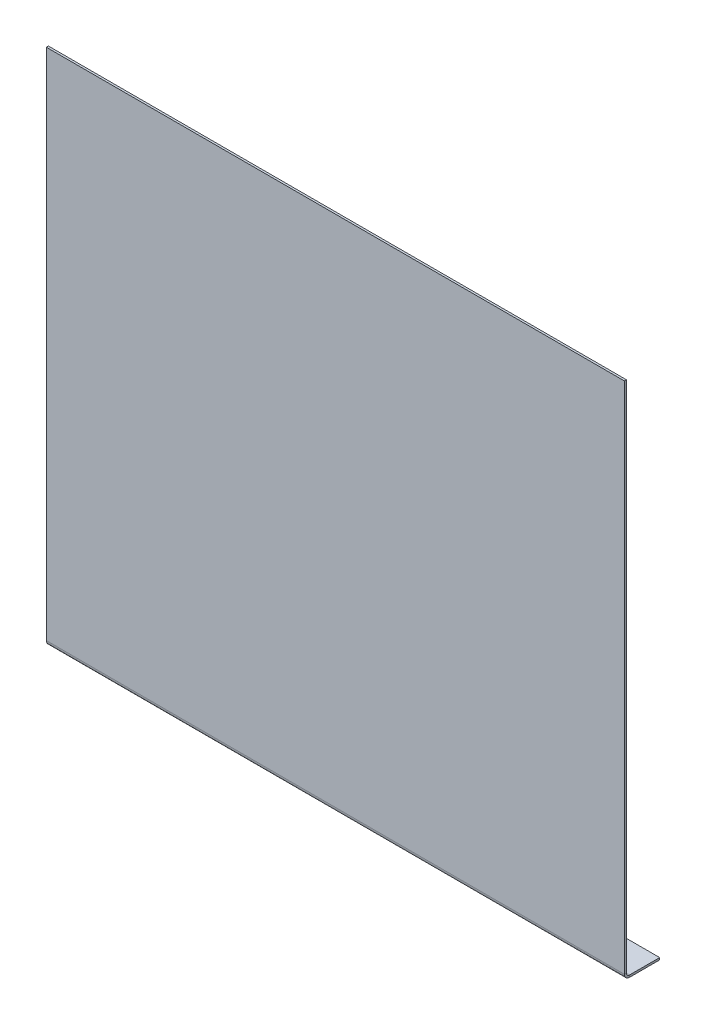
from build123d import *

# Parameters (mm, degrees)
SKETCH1_W          = 180
SKETCH1_H          = 160
BASE_FLANGE1_DEPTH = 0.64
EDGE_FLANGE1_DEPTH = 180
SKETCH31_R         = 2.65
CUT_EXTRUDE1_DEPTH = 185.775539507


# Sheet-metal steps are written as plain solids
with BuildPart() as part:
    # Sketch1 → Base-Flange1 (new body)
    with BuildSketch(Plane.XY):
        with Locations((0, -10)):
            Rectangle(SKETCH1_W, SKETCH1_H)
    extrude(amount=-BASE_FLANGE1_DEPTH)

    # Edge-Flange1 section (across the edge) → Edge-Flange1 (add)
    with BuildSketch(Plane(origin=(90, -91, -0.64), x_dir=(0, 1, 0), z_dir=(-1, 0, 0))):
        with BuildLine():
            Line((-0.64, 1), (-0.64, 10.36))
            Line((-0.64, 10.36), (0, 10.36))
            Line((0, 10.36), (0, 1))
            ThreePointArc((0, 1), (0.292893219, 0.292893219), (1, 0))
            Line((1, 0), (1, -0.64))
            ThreePointArc((1, -0.64), (-0.159655121, -0.159655121), (-0.64, 1))
        make_face()
    extrude(amount=EDGE_FLANGE1_DEPTH)

    # Sketch31 → Cut-Extrude1 (cut, through all)
    with BuildSketch(Plane(origin=(0, -91, 0), x_dir=(1, 0, 0), z_dir=(0, 1, 0))):
        with Locations(Location((80, 6.5, 0), (0, 0, 270))):
            Circle(SKETCH31_R)
        with Locations(Location((-80, 6.5, 0), (0, 0, 90))):
            Circle(SKETCH31_R)
    extrude(amount=-CUT_EXTRUDE1_DEPTH, mode=Mode.SUBTRACT)


solid = part.part
